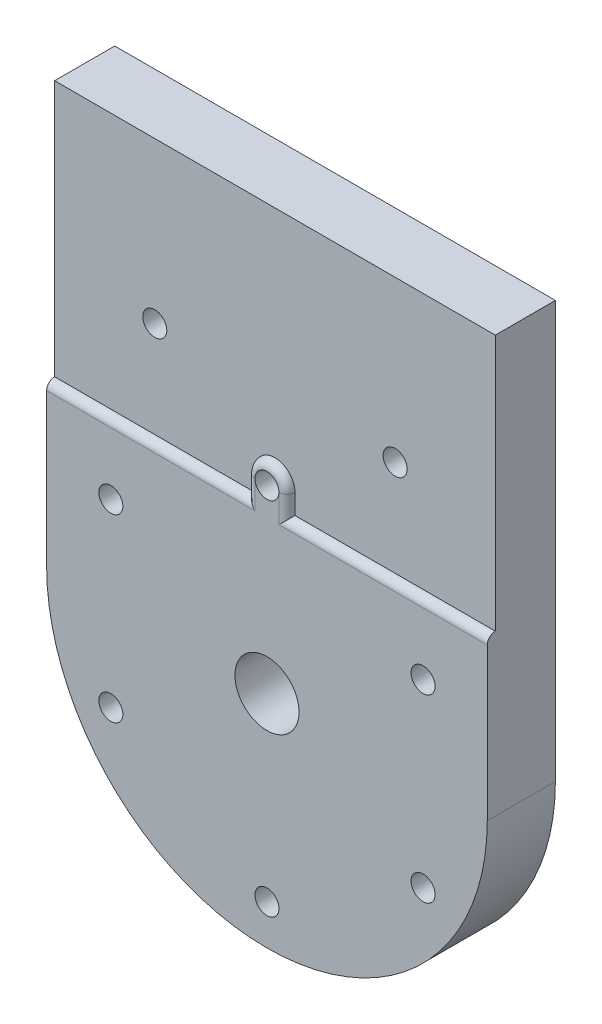
from build123d import *

# Parameters (mm, degrees)
ESQUISSE1_W             = 100
ESQUISSE1_H             = 100.548113933
ESQUISSE1_R             = 4
BOSS_EXTRU_1_DEPTH      = 8.5
ESQUISSE2_R             = 1.5
ENL_V_MAT_EXTRU_1_DEPTH = 73.637800077
ENL_V_MAT_EXTRU_6_DEPTH = 1
CONG_4_R                = 1
ESQUISSE4_R             = 3
ENL_V_MAT_EXTRU_7_DEPTH = 4


with BuildPart() as part:
    # Esquisse1 → Boss.-Extru.1 (new body)
    with BuildSketch(Plane.XY):
        with Locations((0, 1.725943033)):
            Rectangle(ESQUISSE1_W, ESQUISSE1_H)
        Circle(ESQUISSE1_R, mode=Mode.SUBTRACT)
    extrude(amount=BOSS_EXTRU_1_DEPTH)

    # Esquisse2 → Enlèv. mat.-Extru.1 (cut, through all)
    with BuildSketch(Plane.XY.offset(8.5)):
        with BuildLine():
            Line((27.5, 52), (27.5, 0))
            ThreePointArc((27.5, 0), (0, -27.5), (-27.5, 0))
            Line((-27.5, 0), (-27.5, 52))
            Line((-27.5, 52), (-50, 52))
            Line((-50, 52), (-50, -48.548113933))
            Line((-50, -48.548113933), (50, -48.548113933))
            Line((50, -48.548113933), (50, 52))
            Line((50, 52), (27.5, 52))
        make_face()
        with Locations((0, 22.5)):
            Circle(ESQUISSE2_R)
        with Locations((19.485571585, 11.25)):
            Circle(ESQUISSE2_R)
        with Locations((19.485571585, -11.25)):
            Circle(ESQUISSE2_R)
        with Locations((0, -22.5)):
            Circle(ESQUISSE2_R)
        with Locations((-19.485571585, -11.25)):
            Circle(ESQUISSE2_R)
        with Locations((-19.485571585, 11.25)):
            Circle(ESQUISSE2_R)
        with Locations((-15, 32)):
            Circle(ESQUISSE2_R)
        with Locations((15, 32)):
            Circle(ESQUISSE2_R)
    extrude(amount=-ENL_V_MAT_EXTRU_1_DEPTH, mode=Mode.SUBTRACT)

    # Esquisse3 → Enlèv. mat.-Extru.6 (cut)
    with BuildSketch(Plane.XY.offset(8.5)):
        with BuildLine():
            Line((27.5, 52), (-27.5, 52))
            Line((-27.5, 52), (-27.5, 20))
            Line((-27.5, 20), (-2.5, 20))
            Line((-2.5, 20), (-2.5, 22.5))
            ThreePointArc((-2.5, 22.5), (0, 25), (2.5, 22.5))
            Line((2.5, 22.5), (2.5, 20))
            Line((2.5, 20), (27.5, 20))
            Line((27.5, 20), (27.5, 52))
        make_face()
    extrude(amount=-ENL_V_MAT_EXTRU_6_DEPTH, mode=Mode.SUBTRACT)

    # Congé4
    cong_4_edges = [part.edges().sort_by_distance(p)[0] for p in [
        (-15, 20, 8.5),
        (15, 20, 8.5),
        (2.5, 21.25, 8.5),
        (-2.5, 21.25, 8.5),
        (0, 25, 8.5),
    ]]
    fillet(cong_4_edges, radius=CONG_4_R - 0.0001)  # a hair under: the kernel refuses the full size

    # Esquisse4 → Enlèv. mat.-Extru.7 (cut)
    with BuildSketch(Plane(origin=(0, 0, 0), x_dir=(-1, 0, 0), z_dir=(0, 0, -1))):
        with Locations((0, 22.5)):
            Circle(ESQUISSE4_R)
        with Locations((19.485571585, 11.25)):
            Circle(ESQUISSE4_R)
        with Locations((19.485571585, -11.25)):
            Circle(ESQUISSE4_R)
        with Locations((0, -22.5)):
            Circle(ESQUISSE4_R)
        with Locations((-19.485571585, -11.25)):
            Circle(ESQUISSE4_R)
        with Locations((-19.485571585, 11.25)):
            Circle(ESQUISSE4_R)
    extrude(amount=-ENL_V_MAT_EXTRU_7_DEPTH, mode=Mode.SUBTRACT)


solid = part.part
